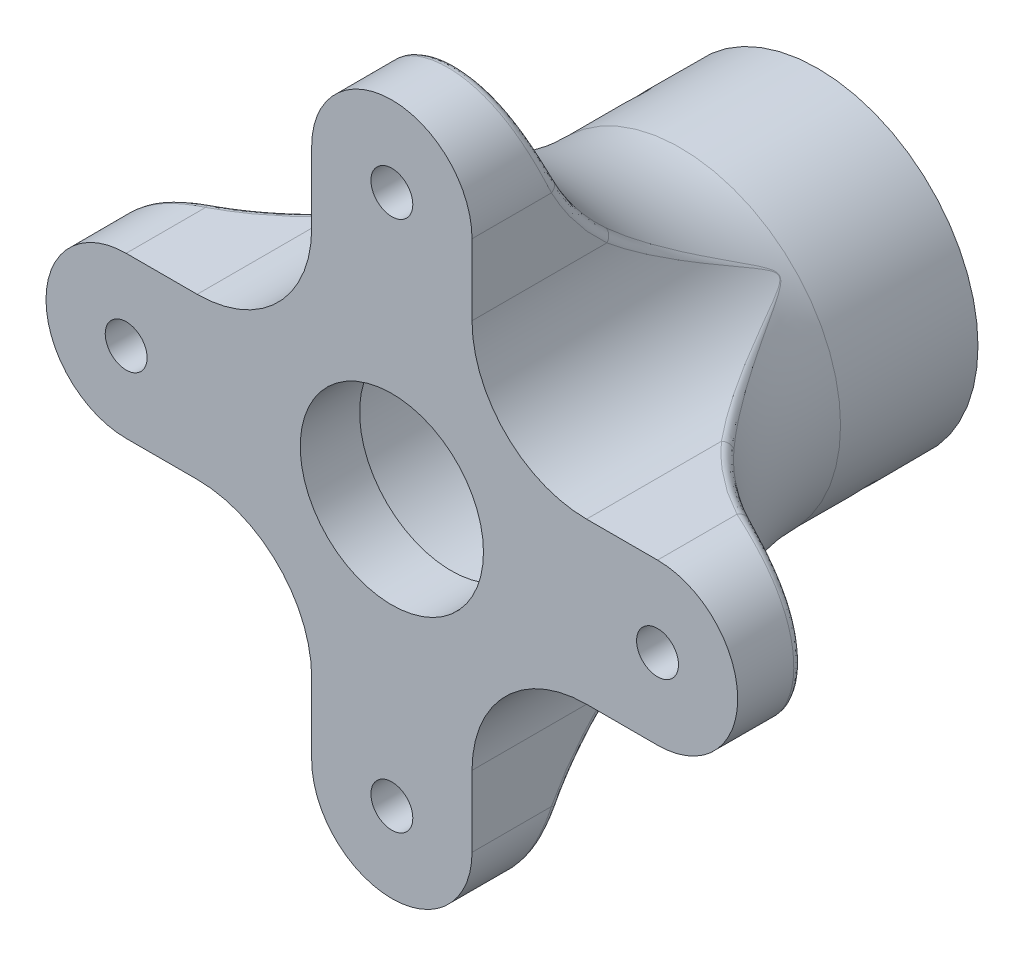
from build123d import *

# Parameters (mm, degrees)
SKETCH1_R               = 10
SKETCH1_R_2             = 2.286
BOSS_EXTRUDE1_DEPTH     = 6.477
CUT_EXTRUDE1_DEPTH      = 3.2385
FILLET15_R              = 12.5
SKETCH2_R               = 17.5
SKETCH2_R_2             = 12.625
BOSS_EXTRUDE2_DEPTH     = 40
FILLET13_START          = -23.387793399
FILLET13_OUTLINE_R      = 17.5
FILLET13_DEPTH          = 23.387793399
FILLET16_R              = 1
CUT_EXTRUDE2_DEPTH      = 67.709257342
CUT_EXTRUDE2_DEPTH_BACK = 67.709257342
SKETCH4_R               = 1.375


with BuildPart() as part:
    # Sketch1 → Boss-Extrude1 (new body)
    with BuildSketch(Plane.XY):
        with BuildLine():
            Line((-8.75, 29), (-8.75, 8.75))
            Line((-8.75, 8.75), (-29, 8.75))
            ThreePointArc((-29, 8.75), (-37.75, 0), (-29, -8.75))
            Line((-29, -8.75), (-8.75, -8.75))
            Line((-8.75, -8.75), (-8.75, -29))
            ThreePointArc((-8.75, -29), (0, -37.75), (8.75, -29))
            Line((8.75, -29), (8.75, -8.75))
            Line((8.75, -8.75), (29, -8.75))
            ThreePointArc((29, -8.75), (37.75, 0), (29, 8.75))
            Line((29, 8.75), (8.75, 8.75))
            Line((8.75, 8.75), (8.75, 29))
            ThreePointArc((8.75, 29), (0, 37.75), (-8.75, 29))
        make_face()
        Circle(SKETCH1_R, mode=Mode.SUBTRACT)
        with Locations((0, 29)):
            Circle(SKETCH1_R_2, mode=Mode.SUBTRACT)
        with Locations((29, 0)):
            Circle(SKETCH1_R_2, mode=Mode.SUBTRACT)
        with Locations((0, -29)):
            Circle(SKETCH1_R_2, mode=Mode.SUBTRACT)
        with Locations((-29, 0)):
            Circle(SKETCH1_R_2, mode=Mode.SUBTRACT)
    extrude(amount=BOSS_EXTRUDE1_DEPTH)

    # Sketch3 → Cut-Extrude1 (cut)
    with BuildSketch(Plane(origin=(0, 0, 0), x_dir=(-1, 0, 0), z_dir=(0, 0, -1))):
        Polygon((26.910280701, -3.6195), (31.089719299, -3.6195), (33.179438599, 0), (31.089719299, 3.6195), (26.910280701, 3.6195), (24.820561401, 0), align=None)
        Polygon((3.6195, 26.910280701), (3.6195, 31.089719299), (0, 33.179438599), (-3.6195, 31.089719299), (-3.6195, 26.910280701), (0, 24.820561401), align=None)
        Polygon((-3.6195, -26.910280701), (-3.6195, -31.089719299), (0, -33.179438599), (3.6195, -31.089719299), (3.6195, -26.910280701), (0, -24.820561401), align=None)
        Polygon((-26.910280701, 3.6195), (-31.089719299, 3.6195), (-33.179438599, 0), (-31.089719299, -3.6195), (-26.910280701, -3.6195), (-24.820561401, 0), align=None)
    extrude(amount=-CUT_EXTRUDE1_DEPTH, mode=Mode.SUBTRACT)

    # Fillet15
    fillet15_edges = [part.edges().sort_by_distance(p)[0] for p in [
        (8.75, 8.75, 3.2385),
        (8.75, -8.75, 3.2385),
        (-8.75, -8.75, 3.2385),
        (-8.75, 8.75, 3.2385),
    ]]
    fillet(fillet15_edges, radius=FILLET15_R)

    # Sketch2 → Boss-Extrude2 (add)
    with BuildSketch(Plane(origin=(0, 0, 0), x_dir=(-1, 0, 0), z_dir=(0, 0, -1))):
        with Locations(Location((0, 0, 0), (0, 0, 180))):
            Circle(SKETCH2_R)
        Circle(SKETCH2_R_2, mode=Mode.SUBTRACT)
    extrude(amount=BOSS_EXTRUDE2_DEPTH)

    # Fillet13: read off the stored shape, not the designer's step
    # Fillet13 outline → Fillet13 (add)
    with BuildSketch(Plane.XY.offset(FILLET13_START)):
        with BuildLine():
            ThreePointArc((8.75, 29), (0, 37.75), (-8.75, 29))
            Line((-8.75, 29), (-8.75, 21.25))
            ThreePointArc((-8.75, 21.25), (-12.411165235, 12.411165235), (-21.25, 8.75))
            Line((-21.25, 8.75), (-29, 8.75))
            ThreePointArc((-29, 8.75), (-37.75, 0), (-29, -8.75))
            Line((-29, -8.75), (-21.25, -8.75))
            ThreePointArc((-21.25, -8.75), (-12.411165235, -12.411165235), (-8.75, -21.25))
            Line((-8.75, -21.25), (-8.75, -29))
            ThreePointArc((-8.75, -29), (0, -37.75), (8.75, -29))
            Line((8.75, -29), (8.75, -21.25))
            ThreePointArc((8.75, -21.25), (12.411165235, -12.411165235), (21.25, -8.75))
            Line((21.25, -8.75), (29, -8.75))
            ThreePointArc((29, -8.75), (37.75, 0), (29, 8.75))
            Line((29, 8.75), (21.25, 8.75))
            ThreePointArc((21.25, 8.75), (12.411165235, 12.411165235), (8.75, 21.25))
            Line((8.75, 21.25), (8.75, 29))
        make_face()
        Polygon((0, -24.820561401), (3.6195, -26.910280701), (3.6195, -31.089719299), (0, -33.179438599), (-3.6195, -31.089719299), (-3.6195, -26.910280701), align=None, mode=Mode.SUBTRACT)
        Polygon((-24.820561401, 0), (-26.910280701, -3.6195), (-31.089719299, -3.6195), (-33.179438599, 0), (-31.089719299, 3.6195), (-26.910280701, 3.6195), align=None, mode=Mode.SUBTRACT)
        Circle(FILLET13_OUTLINE_R, mode=Mode.SUBTRACT)
        Polygon((26.910280701, 3.6195), (31.089719299, 3.6195), (33.179438599, 0), (31.089719299, -3.6195), (26.910280701, -3.6195), (24.820561401, 0), align=None, mode=Mode.SUBTRACT)
        Polygon((-3.6195, 26.910280701), (-3.6195, 31.089719299), (0, 33.179438599), (3.6195, 31.089719299), (3.6195, 26.910280701), (0, 24.820561401), align=None, mode=Mode.SUBTRACT)
    extrude(amount=FILLET13_DEPTH)

    # Fillet13 2 outline → Fillet13 2 (revolve, cut)
    with BuildSketch(Plane.XZ):
        with BuildLine():
            Line((37.75, -23.387793399), (37.750006844, -0.455396418))
            ThreePointArc((37.750006844, -0.455396418), (23.739247415, -8.476254588), (17.552038362, -23.387793399))
            Line((17.552038362, -23.387793399), (37.75, -23.387793399))
        make_face()
    revolve(axis=Axis((0, 0, 0), (0, 0, 1)), mode=Mode.SUBTRACT)

    # Fillet13 3 outline → Fillet13 3 (revolve)
    with BuildSketch(Plane.XZ):
        with BuildLine():
            ThreePointArc((17.5, -25), (17.513012977, -24.193476889), (17.552038362, -23.387793399))
            Line((17.552038362, -23.387793399), (17.5, -23.387793399))
            Line((17.5, -23.387793399), (17.5, -25))
        make_face()
    revolve(axis=Axis((0, 0, 0), (0, 0, 1)))

    # Fillet16
    fillet16_edges = [part.edges().sort_by_distance(p)[0] for p in [
        (9.747013784, 16.358036371, -16.356377062),
        (8.75, 24.841620986, -5.927074305),
        (-6.314634768, 35.057052724, -0.964974877),
        (-8.75, 24.841620986, -5.927074305),
        (-9.747013784, 16.358036371, -16.356377062),
        (-24.841620986, 8.75, -5.927074305),
        (-35.057052728, -6.314634768, -0.964974875),
        (-24.841620986, -8.75, -5.927074305),
        (-16.35803637, -9.747013784, -16.356377064),
        (-8.75, -24.841620986, -5.927074305),
        (6.314634766, -35.057052728, -0.964974875),
        (8.75, -24.841620986, -5.927074305),
        (9.747013784, -16.358036371, -16.356377062),
        (24.841620986, -8.75, -5.927074305),
        (37.75, 0, -0.455397742),
        (24.841620986, 8.75, -5.927074305),
        (16.358036371, 9.747013784, -16.356377062),
    ]]
    fillet(fillet16_edges, radius=FILLET16_R)

    # Sketch4 → Cut-Extrude2 (cut, two sides: drawn at the far end of the back side and taken through both)
    with BuildSketch(Plane(origin=(0, 0, 0), x_dir=(-0.7071067811865477, -0.7071067811865474, 0), z_dir=(0.7071067811865474, -0.7071067811865477, 0)).offset(-CUT_EXTRUDE2_DEPTH_BACK)):
        with Locations(Location((0, 32.5, 0), (0, 0, 180))):
            Circle(SKETCH4_R)
    extrude(amount=CUT_EXTRUDE2_DEPTH + CUT_EXTRUDE2_DEPTH_BACK, mode=Mode.SUBTRACT)


solid = part.part
